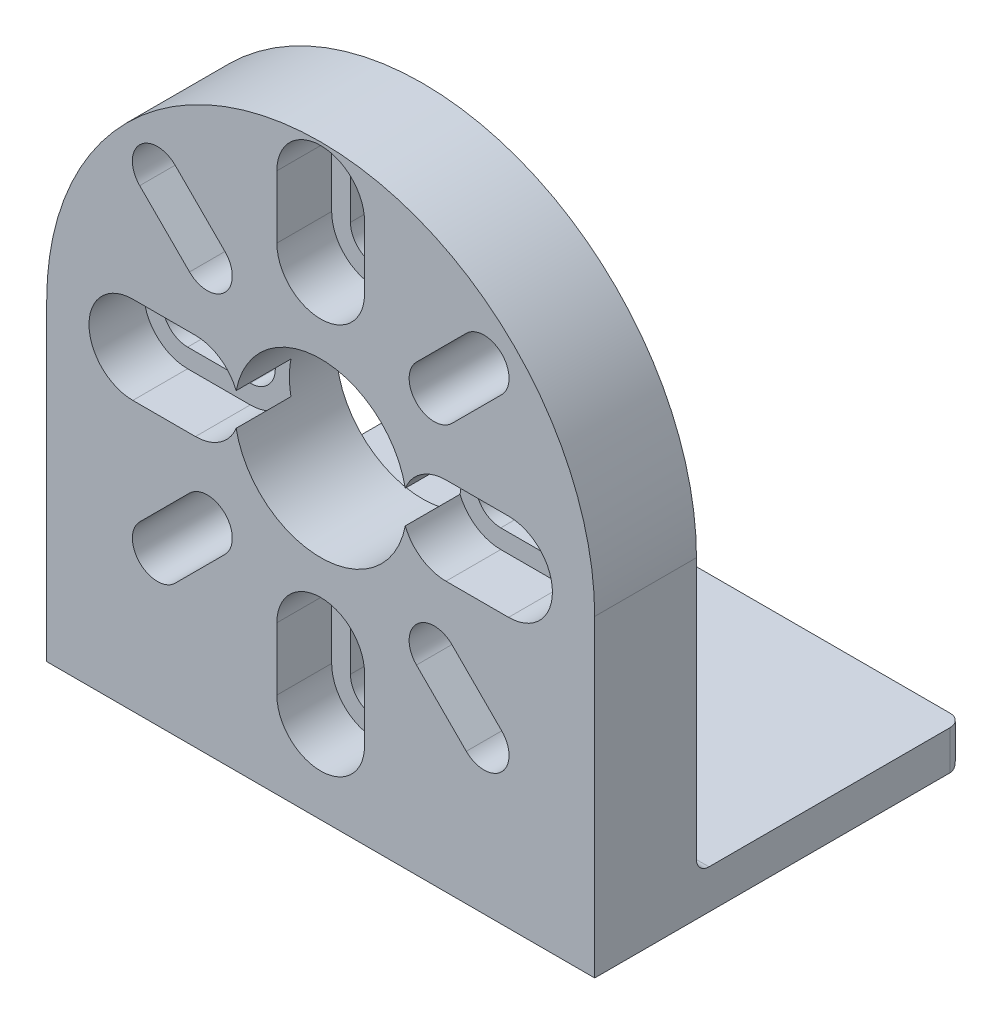
from build123d import *
from build123d.topology import SkipClean

# Parameters (mm, degrees)
SKETCH_1_R          = 17.5
EXTRUDE_1_DEPTH     = 3
EXTRUDE_START       = -20
EXTRUDE_2_DEPTH     = 20
SKETCH_3_W          = 42.038336367
SKETCH_3_H          = 17.5
CUT_EXTRUDE_2_DEPTH = 17
FILLET_1_R          = 0.8
SKETCH_4_R          = 5.5
CUT_EXTRUDE_3_DEPTH = 32.547583109
SKETCH_5_R          = 5.5
EXTRUDE_3_DEPTH     = 3.5
CUT_EXTRUDE_START   = -3.5
CUT_EXTRUDE_5_DEPTH = 3.5
CUT_EXTRUDE_6_DEPTH = 6.5


with BuildPart() as part:
    # 草图1 → 凸台-拉伸1 (new body)
    with BuildSketch(Plane.XY):
        Circle(SKETCH_1_R)
        with BuildLine():
            Line((1.6, 14.5), (1.6, 10.5))
            ThreePointArc((1.6, 10.5), (0, 8.9), (-1.6, 10.5))
            Line((-1.6, 10.5), (-1.6, 14.5))
            ThreePointArc((-1.6, 14.5), (0, 16.1), (1.6, 14.5))
        make_face(mode=Mode.SUBTRACT)
        with BuildLine():
            Line((1.6, -14.5), (1.6, -10.5))
            ThreePointArc((1.6, -10.5), (0, -8.9), (-1.6, -10.5))
            Line((-1.6, -10.5), (-1.6, -14.5))
            ThreePointArc((-1.6, -14.5), (0, -16.1), (1.6, -14.5))
        make_face(mode=Mode.SUBTRACT)
        with BuildLine():
            Line((-12, 1.6), (-8, 1.6))
            ThreePointArc((-8, 1.6), (-6.4, 0), (-8, -1.6))
            Line((-8, -1.6), (-12, -1.6))
            ThreePointArc((-12, -1.6), (-13.6, 0), (-12, 1.6))
        make_face(mode=Mode.SUBTRACT)
        with BuildLine():
            Line((12, 1.6), (8, 1.6))
            ThreePointArc((8, 1.6), (6.4, 0), (8, -1.6))
            Line((8, -1.6), (12, -1.6))
            ThreePointArc((12, -1.6), (13.6, 0), (12, 1.6))
        make_face(mode=Mode.SUBTRACT)
    extrude(amount=EXTRUDE_1_DEPTH)

    # 草图2 → 凸台-拉伸2 (add)
    with BuildSketch(Plane.XY.offset(3).offset(EXTRUDE_START)):
        with BuildLine():
            Line((-17.5, -20), (17.5, -20))
            Line((17.5, -20), (17.5, 0))
            ThreePointArc((17.5, 0), (0, -17.5), (-17.5, 0))
            Line((-17.5, 0), (-17.5, -20))
        make_face()
    extrude(amount=EXTRUDE_2_DEPTH)

    # 草图3 → 切除-拉伸2 (cut)
    with BuildSketch(Plane(origin=(0, 0, -17), x_dir=(-1, 0, 0), z_dir=(0, 0, -1))):
        with Locations((-0.801424091, -8.75)):
            Rectangle(SKETCH_3_W, SKETCH_3_H)
    extrude(amount=-CUT_EXTRUDE_2_DEPTH, mode=Mode.SUBTRACT)

    # 圆角1
    fillet_1_edges = [part.edges().sort_by_distance(p)[0] for p in [
        (17.5, -18.75, -17),
        (0, -20, -17),
        (-17.5, -18.75, -17),
        (0, -17.5, 0),
    ]]
    fillet(fillet_1_edges, radius=FILLET_1_R)

    # 草图4 → 切除-拉伸3 (cut, through all)
    with BuildSketch(Plane(origin=(0, 0, 0), x_dir=(-1, 0, 0), z_dir=(0, 0, -1))):
        Circle(SKETCH_4_R)
    extrude(amount=-CUT_EXTRUDE_3_DEPTH, mode=Mode.SUBTRACT)

    # 草图5 → 凸台-拉伸3 (add)
    with SkipClean():  # the faces are left unmerged after this step: merging them gives an invalid solid
        with BuildSketch(Plane.XY.offset(3)):
            with BuildLine():
                Line((-17.5, 0), (-17.5, -20))
                Line((-17.5, -20), (17.5, -20))
                Line((17.5, -20), (17.5, 0))
                ThreePointArc((17.5, 0), (0, 17.5), (-17.5, 0))
            make_face()
            with Locations(Location((0, 0, 0), (0, 0, 180))):
                Circle(SKETCH_5_R, mode=Mode.SUBTRACT)
            with BuildLine():
                Line((1.6, -14.5), (1.6, -10.5))
                ThreePointArc((1.6, -10.5), (0, -8.9), (-1.6, -10.5))
                Line((-1.6, -10.5), (-1.6, -14.5))
                ThreePointArc((-1.6, -14.5), (0, -16.1), (1.6, -14.5))
            make_face(mode=Mode.SUBTRACT)
            with BuildLine():
                Line((-8, 1.6), (-12, 1.6))
                ThreePointArc((-12, 1.6), (-13.6, 0), (-12, -1.6))
                Line((-12, -1.6), (-8, -1.6))
                ThreePointArc((-8, -1.6), (-6.4, 0), (-8, 1.6))
            make_face(mode=Mode.SUBTRACT)
            with BuildLine():
                Line((8, -1.6), (12, -1.6))
                ThreePointArc((12, -1.6), (13.6, 0), (12, 1.6))
                Line((12, 1.6), (8, 1.6))
                ThreePointArc((8, 1.6), (6.4, 0), (8, -1.6))
            make_face(mode=Mode.SUBTRACT)
            with BuildLine():
                Line((1.6, 10.5), (1.6, 14.5))
                ThreePointArc((1.6, 14.5), (0, 16.1), (-1.6, 14.5))
                Line((-1.6, 14.5), (-1.6, 10.5))
                ThreePointArc((-1.6, 10.5), (0, 8.9), (1.6, 10.5))
            make_face(mode=Mode.SUBTRACT)
        extrude(amount=EXTRUDE_3_DEPTH)
    add(part.part.scale(1), mode=Mode.REPLACE)  # the faces are merged on a copy

    # 草图7 → 切除-拉伸5 (cut)
    # profile 1 of 4: a face of its own
    with BuildSketch(Plane.XY.offset(6.5).offset(CUT_EXTRUDE_START)):
        with BuildLine():
            Line((2.8, -14.5), (2.8, -10.5))
            ThreePointArc((2.8, -10.5), (0, -7.7), (-2.8, -10.5))
            Line((-2.8, -10.5), (-2.8, -14.5))
            ThreePointArc((-2.8, -14.5), (0, -17.3), (2.8, -14.5))
        make_face()
        with BuildLine():
            Line((1.6, -14.5), (1.6, -10.5))
            ThreePointArc((1.6, -10.5), (0, -8.9), (-1.6, -10.5))
            Line((-1.6, -10.5), (-1.6, -14.5))
            ThreePointArc((-1.6, -14.5), (0, -16.1), (1.6, -14.5))
        make_face(mode=Mode.SUBTRACT)
    # profile 2 of 4: a face of its own
    with BuildSketch(Plane.XY.offset(6.5).offset(CUT_EXTRUDE_START)):
        with BuildLine():
            Line((8, -2.8), (12, -2.8))
            ThreePointArc((12, -2.8), (14.8, 0), (12, 2.8))
            Line((12, 2.8), (8, 2.8))
            ThreePointArc((8, 2.8), (5.2, 0), (8, -2.8))
        make_face()
        with BuildLine():
            Line((8, -1.6), (12, -1.6))
            ThreePointArc((12, -1.6), (13.6, 0), (12, 1.6))
            Line((12, 1.6), (8, 1.6))
            ThreePointArc((8, 1.6), (6.4, 0), (8, -1.6))
        make_face(mode=Mode.SUBTRACT)
    # profile 3 of 4: a face of its own
    with BuildSketch(Plane.XY.offset(6.5).offset(CUT_EXTRUDE_START)):
        with BuildLine():
            Line((-12, -2.8), (-8, -2.8))
            ThreePointArc((-8, -2.8), (-5.2, 0), (-8, 2.8))
            Line((-8, 2.8), (-12, 2.8))
            ThreePointArc((-12, 2.8), (-14.8, 0), (-12, -2.8))
        make_face()
        with BuildLine():
            Line((-12, -1.6), (-8, -1.6))
            ThreePointArc((-8, -1.6), (-6.4, 0), (-8, 1.6))
            Line((-8, 1.6), (-12, 1.6))
            ThreePointArc((-12, 1.6), (-13.6, 0), (-12, -1.6))
        make_face(mode=Mode.SUBTRACT)
    # profile 4 of 4: a face of its own
    with BuildSketch(Plane.XY.offset(6.5).offset(CUT_EXTRUDE_START)):
        with BuildLine():
            Line((2.8, 10.5), (2.8, 14.5))
            ThreePointArc((2.8, 14.5), (0, 17.3), (-2.8, 14.5))
            Line((-2.8, 14.5), (-2.8, 10.5))
            ThreePointArc((-2.8, 10.5), (0, 7.7), (2.8, 10.5))
        make_face()
        with BuildLine():
            Line((1.6, 10.5), (1.6, 14.5))
            ThreePointArc((1.6, 14.5), (0, 16.1), (-1.6, 14.5))
            Line((-1.6, 14.5), (-1.6, 10.5))
            ThreePointArc((-1.6, 10.5), (0, 8.9), (1.6, 10.5))
        make_face(mode=Mode.SUBTRACT)
    extrude(amount=CUT_EXTRUDE_5_DEPTH, mode=Mode.SUBTRACT)

    # 草图8 → 切除-拉伸6 (cut)
    with BuildSketch(Plane.XY.offset(6.5)):
        with BuildLine():
            Line((11.561195872, 9.298454173), (8.379215357, 6.116473657))
            ThreePointArc((8.379215357, 6.116473657), (6.116473657, 6.116473657), (6.116473657, 8.379215357))
            Line((6.116473657, 8.379215357), (9.298454173, 11.561195872))
            ThreePointArc((9.298454173, 11.561195872), (11.561195872, 11.561195872), (11.561195872, 9.298454173))
        make_face()
        with BuildLine():
            Line((-8.379215357, 6.116473657), (-11.561195872, 9.298454173))
            ThreePointArc((-11.561195872, 9.298454173), (-11.561195872, 11.561195872), (-9.298454173, 11.561195872))
            Line((-9.298454173, 11.561195872), (-6.116473657, 8.379215357))
            ThreePointArc((-6.116473657, 8.379215357), (-6.116473657, 6.116473657), (-8.379215357, 6.116473657))
        make_face()
        with BuildLine():
            Line((6.116473657, -8.379215357), (9.298454173, -11.561195872))
            ThreePointArc((9.298454173, -11.561195872), (11.561195872, -11.561195872), (11.561195872, -9.298454173))
            Line((11.561195872, -9.298454173), (8.379215357, -6.116473657))
            ThreePointArc((8.379215357, -6.116473657), (6.116473657, -6.116473657), (6.116473657, -8.379215357))
        make_face()
        with BuildLine():
            Line((-9.298454173, -11.561195872), (-6.116473657, -8.379215357))
            ThreePointArc((-6.116473657, -8.379215357), (-6.116473657, -6.116473657), (-8.379215357, -6.116473657))
            Line((-8.379215357, -6.116473657), (-11.561195872, -9.298454173))
            ThreePointArc((-11.561195872, -9.298454173), (-11.561195872, -11.561195872), (-9.298454173, -11.561195872))
        make_face()
    extrude(amount=-CUT_EXTRUDE_6_DEPTH, mode=Mode.SUBTRACT)


solid = part.part
